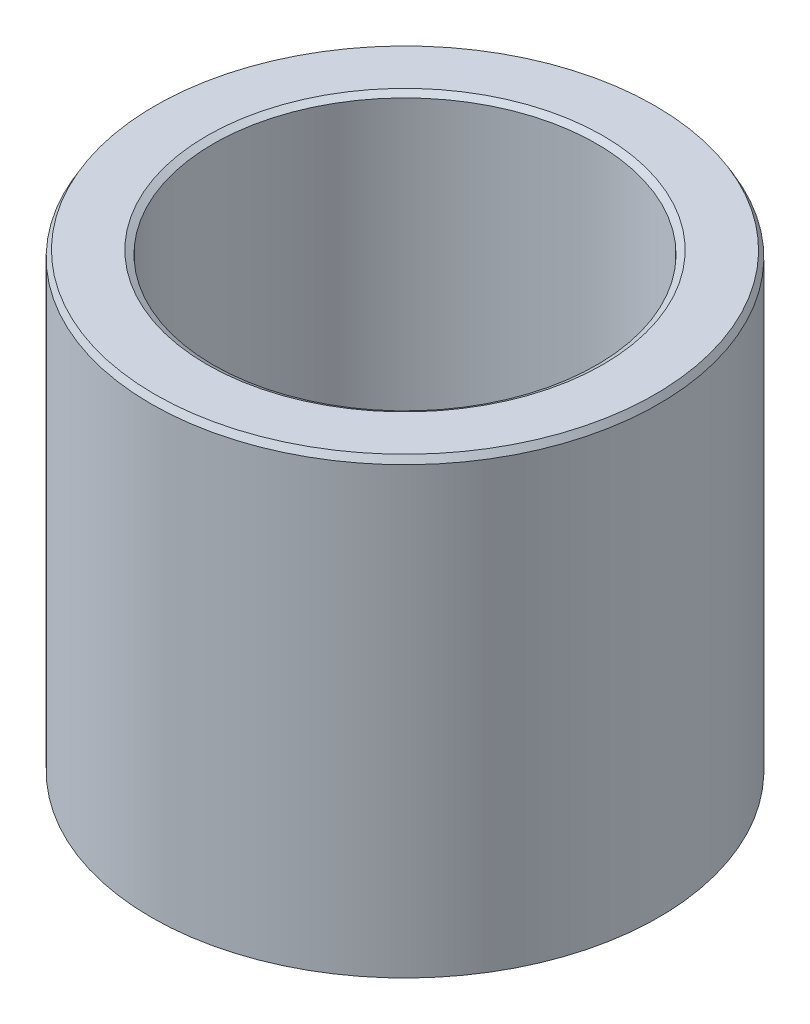
from build123d import *
from OCP.BRepFilletAPI import BRepFilletAPI_MakeChamfer

# Parameters (mm, degrees)
SKETCH1_R           = 40
BOSS_EXTRUDE1_DEPTH = 71.67814612
SKETCH2_R           = 30.215207213
CUT_EXTRUDE1_DEPTH  = 92.311317103
CHAMFER1_SIZE       = 1.015228214
CHAMFER1_SIZE2      = 0.586142282


with BuildPart() as part:
    # Sketch1 → Boss-Extrude1 (new body)
    with BuildSketch(Plane(origin=(0, 0, 0), x_dir=(1, 0, 0), z_dir=(0, 1, 0))):
        Circle(SKETCH1_R)
    extrude(amount=BOSS_EXTRUDE1_DEPTH)

    # Sketch2 → Cut-Extrude1 (cut, through all)
    with BuildSketch(Plane(origin=(0, 0, 0), x_dir=(1, 0, 0), z_dir=(0, 1, 0))):
        Circle(SKETCH2_R)
    extrude(amount=CUT_EXTRUDE1_DEPTH, mode=Mode.SUBTRACT)

    # Chamfer1: one chamfer whose edges measure the first distance from different faces: ONE call of the kernel's chamfer builder (chamfer() names one face for all edges)
    chamfer1_edges_1 = [part.edges().sort_by_distance(p)[0] for p in [
        (-30.215207213, 71.67814612, 0),
    ]]
    chamfer1_side_1 = [part.faces().sort_by_distance(p)[0] for p in [
        (-38.86862915, 71.67814612, 0),
    ]]
    chamfer1_edges_2 = [part.edges().sort_by_distance(p)[0] for p in [
        (-30.215207213, 0, 0),
    ]]
    chamfer1_side_2 = [part.faces().sort_by_distance(p)[0] for p in [
        (-30.215207213, 35.83907306, 0),
    ]]
    chamfer1_edges_3 = [part.edges().sort_by_distance(p)[0] for p in [
        (-40, 0, 0),
    ]]
    chamfer1_side_3 = [part.faces().sort_by_distance(p)[0] for p in [
        (-38.86862915, 0, 0),
    ]]
    chamfer1_edges_4 = [part.edges().sort_by_distance(p)[0] for p in [
        (-40, 71.67814612, 0),
    ]]
    chamfer1_side_4 = [part.faces().sort_by_distance(p)[0] for p in [
        (-40, 35.83907306, 0),
    ]]
    chamfer1 = BRepFilletAPI_MakeChamfer(part.part.solid().wrapped)
    for e in chamfer1_edges_1:
        chamfer1.Add(CHAMFER1_SIZE, CHAMFER1_SIZE2, e.wrapped, chamfer1_side_1[0].wrapped)  # the first distance lies on this face
    for e in chamfer1_edges_2:
        chamfer1.Add(CHAMFER1_SIZE, CHAMFER1_SIZE2, e.wrapped, chamfer1_side_2[0].wrapped)  # the first distance lies on this face
    for e in chamfer1_edges_3:
        chamfer1.Add(CHAMFER1_SIZE, CHAMFER1_SIZE2, e.wrapped, chamfer1_side_3[0].wrapped)  # the first distance lies on this face
    for e in chamfer1_edges_4:
        chamfer1.Add(CHAMFER1_SIZE, CHAMFER1_SIZE2, e.wrapped, chamfer1_side_4[0].wrapped)  # the first distance lies on this face
    add(Compound.cast(chamfer1.Shape()), mode=Mode.REPLACE)


solid = part.part
